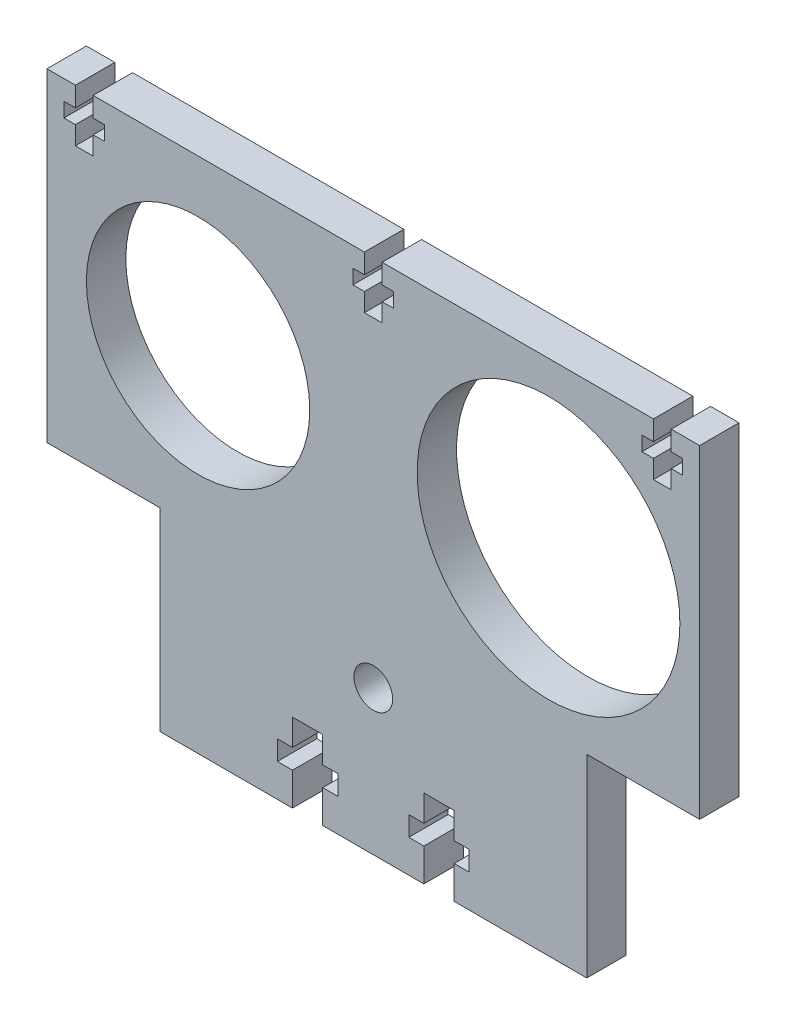
from build123d import *

# Parameters (mm, degrees)
SKETCH1_R           = 2.95
SKETCH1_R_2         = 17
SKETCH1_R_3         = 20
BOSS_EXTRUDE1_DEPTH = 6
CUT_EXTRUDE2_DEPTH  = 76.689323992
CUT_EXTRUDE3_DEPTH  = 76.689323992


with BuildPart() as part:
    # Sketch1 → Boss-Extrude1 (new body)
    with BuildSketch(Plane.XY):
        Polygon((-32.5, 7.5), (-32.5, -22), (32.5, -22), (32.5, 7.5), (49.675685802, 7.5), (49.675685802, 56.790844389), (-49.675685802, 56.790844389), (-49.675685802, 7.5), align=None)
        Circle(SKETCH1_R, mode=Mode.SUBTRACT)
        with Locations((-26.675685802, 31.790844389)):
            Circle(SKETCH1_R_2, mode=Mode.SUBTRACT)
        with Locations((26.675685802, 31.790844389)):
            Circle(SKETCH1_R_3, mode=Mode.SUBTRACT)
    extrude(amount=BOSS_EXTRUDE1_DEPTH)

    # Sketch3 → Cut-Extrude2 (cut, through all)
    with BuildSketch(Plane.XY.offset(6)):
        Polygon((-12.3, -22), (-7.7, -22), (-7.7, -17), (-5.4, -17), (-5.4, -14), (-7.7, -14), (-7.7, -10), (-12.3, -10), (-12.3, -14), (-14.6, -14), (-14.6, -17), (-12.3, -17), align=None)
        Polygon((7.7, -14), (7.7, -10), (12.3, -10), (12.3, -14), (14.6, -14), (14.6, -17), (12.3, -17), (12.3, -22), (7.7, -22), (7.7, -17), (5.4, -17), (5.4, -14), align=None)
    extrude(amount=-CUT_EXTRUDE2_DEPTH, mode=Mode.SUBTRACT)

    # Sketch4 → Cut-Extrude3 (cut, through all)
    with BuildSketch(Plane.XY.offset(6)):
        Polygon((42.65, 56.790844389), (42.65, 53.790844389), (40.9, 53.790844389), (40.9, 51.590844389), (42.65, 51.590844389), (42.65, 48.790844389), (45.35, 48.790844389), (45.35, 51.590844389), (47.1, 51.590844389), (47.1, 53.790844389), (45.35, 53.790844389), (45.35, 56.790844389), align=None)
        Polygon((-45.35, 56.790844389), (-42.65, 56.790844389), (-42.65, 53.790844389), (-40.9, 53.790844389), (-40.9, 51.590844389), (-42.65, 51.590844389), (-42.65, 48.790844389), (-45.35, 48.790844389), (-45.35, 51.590844389), (-47.1, 51.590844389), (-47.1, 53.790844389), (-45.35, 53.790844389), align=None)
        Polygon((-1.35, 56.790844389), (1.35, 56.790844389), (1.35, 53.790844389), (3.1, 53.790844389), (3.1, 51.590844389), (1.35, 51.590844389), (1.35, 48.790844389), (-1.35, 48.790844389), (-1.35, 51.590844389), (-3.1, 51.590844389), (-3.1, 53.790844389), (-1.35, 53.790844389), align=None)
    extrude(amount=-CUT_EXTRUDE3_DEPTH, mode=Mode.SUBTRACT)


solid = part.part
